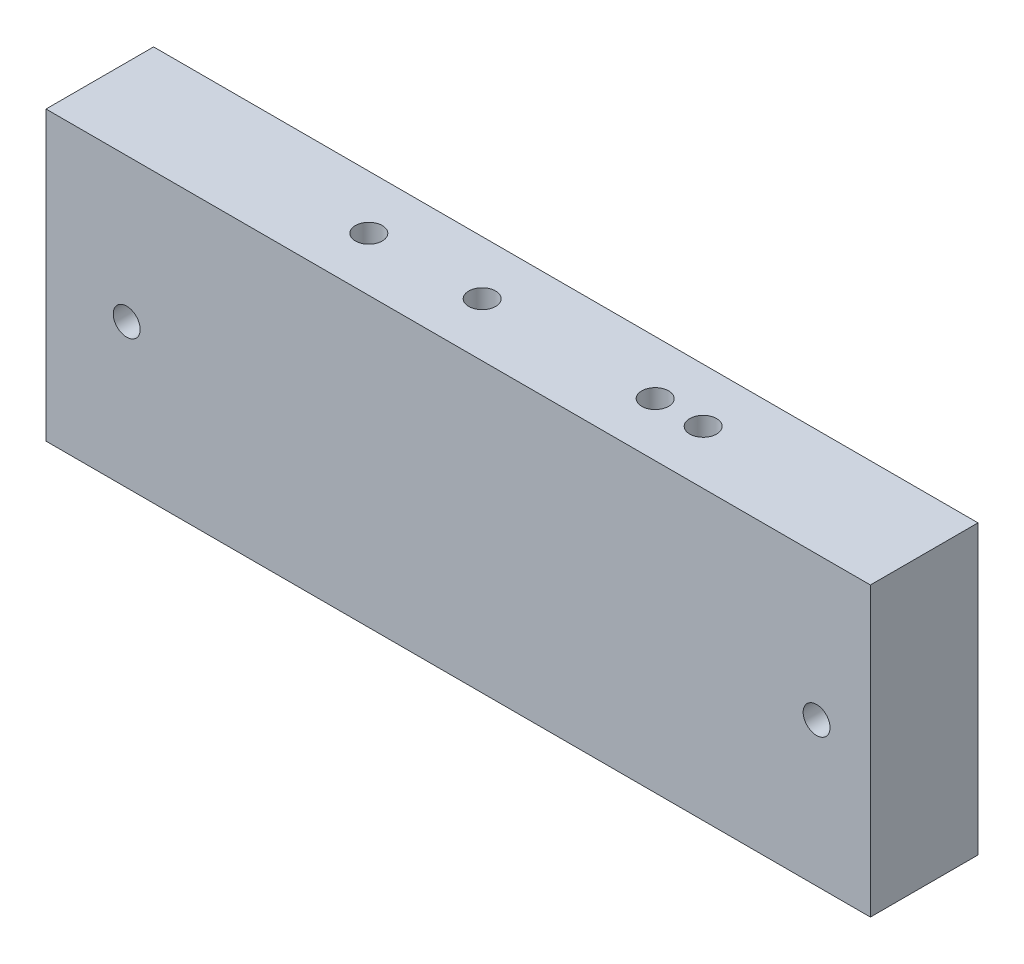
from build123d import *

# Parameters (mm, degrees)
SKETCH1_W           = 97.3
SKETCH1_H           = 33.95
BOSS_EXTRUDE1_DEPTH = 12.7
HOLE1_D             = 3.175
HOLE1_DEPTH         = 31.75
HOLE1_CSINK_D       = 10.16
HOLE1_CSINK_ANGLE   = 82
HOLE1_TIP           = 0.953866233
HOLE2_D             = 3.175
HOLE2_DEPTH         = 31.75
HOLE2_CSINK_D       = 10.16
HOLE2_CSINK_ANGLE   = 82
HOLE2_TIP           = 0.953866233
HOLE5_D             = 3.175
HOLE5_DEPTH         = 31.75
HOLE5_CSINK_D       = 10.16
HOLE5_CSINK_ANGLE   = 82
HOLE5_TIP           = 0.953866233
HOLE6_D             = 3.175
HOLE6_DEPTH         = 31.75
HOLE6_CSINK_D       = 10.16
HOLE6_CSINK_ANGLE   = 82
HOLE6_TIP           = 0.953866233


with BuildPart() as part:
    # Sketch1 → Boss-Extrude1 (new body)
    with BuildSketch(Plane.XY):
        with Locations((-292.654465963, -36.025)):
            Rectangle(SKETCH1_W, SKETCH1_H)
    extrude(amount=-BOSS_EXTRUDE1_DEPTH)

    # Hole1
    with Locations(Plane(origin=(-124.004465969, 0, 78.475709941), x_dir=(-1, 0, 0), z_dir=(0, 1, 0))):
        with Locations((126.349999994, 72.474290059), (146.083333327, -84.825709941), (172.166666661, -84.825709941), (126.349999994, -54.375709941), (126.349999994, 42.024290059), (-172.166666661, -84.825709941), (-146.083333327, -84.825709941), (-126.349999994, -54.375709941), (-126.349999994, 42.024290059), (-126.349999994, 72.474290059)):
            CounterSinkHole(HOLE1_D / 2, HOLE1_CSINK_D / 2, depth=HOLE1_DEPTH, counter_sink_angle=HOLE1_CSINK_ANGLE)
            with Locations((0, 0, -(HOLE1_DEPTH + HOLE1_TIP / 2))):  # 118° drill point
                Cone(0, HOLE1_D / 2, HOLE1_TIP, mode=Mode.SUBTRACT)

    # Hole2
    with Locations(Plane(origin=(-124.004465969, -72.05, 78.475709941), x_dir=(1, 0, 0), z_dir=(0, -1, 0))):
        with Locations((126.349999994, 72.474290059), (146.083333327, -84.825709941), (172.166666661, -84.825709941), (126.349999994, -54.375709941), (126.349999994, 42.024290059), (-172.166666661, -84.825709941), (-146.083333327, -84.825709941), (-126.349999994, -54.375709941), (-126.349999994, 42.024290059), (-126.349999994, 72.474290059)):
            CounterSinkHole(HOLE2_D / 2, HOLE2_CSINK_D / 2, depth=HOLE2_DEPTH, counter_sink_angle=HOLE2_CSINK_ANGLE)
            with Locations((0, 0, -(HOLE2_DEPTH + HOLE2_TIP / 2))):  # 118° drill point
                Cone(0, HOLE2_D / 2, HOLE2_TIP, mode=Mode.SUBTRACT)

    # Hole5
    with Locations(Plane(origin=(-124.004465969, -208.286738577, -12.7), x_dir=(-1, 0, 0), z_dir=(0, 0, -1))):
        with Locations((207.774999994, 172.261738577), (126.349999994, 172.261738577)):
            CounterSinkHole(HOLE5_D / 2, HOLE5_CSINK_D / 2, depth=HOLE5_DEPTH, counter_sink_angle=HOLE5_CSINK_ANGLE)
            with Locations((0, 0, -(HOLE5_DEPTH + HOLE5_TIP / 2))):  # 118° drill point
                Cone(0, HOLE5_D / 2, HOLE5_TIP, mode=Mode.SUBTRACT)

    # Hole6
    with Locations(Plane(origin=(-124.004465969, -6.35, 78.475709941), x_dir=(-1, 0, 0), z_dir=(0, 1, 0))):
        with Locations((-207.774999994, 244.12141023), (-207.774999994, 136.58903684), (-207.774999994, 48.524290059), (-185.549999994, -84.825709941), (-151.749999994, -84.825709941), (-94.599999994, 72.474290059), (94.599999994, 72.474290059), (151.749999994, -84.825709941), (185.549999994, -84.825709941), (207.774999994, 48.524290059), (207.774999994, 136.58903684), (207.774999994, 244.12141023), (166.795833328, 213.070350905), (40.979166666, 213.070350905), (-40.979166666, 213.070350905), (-166.795833328, 213.070350905), (0, 104.224290059), (0, 213.070350905), (0, 323.466411751), (-126.349999994, 34.524290059), (-126.349999994, -46.875709941), (126.349999994, -46.875709941), (126.349999994, 34.524290059)):
            CounterSinkHole(HOLE6_D / 2, HOLE6_CSINK_D / 2, depth=HOLE6_DEPTH, counter_sink_angle=HOLE6_CSINK_ANGLE)
            with Locations((0, 0, -(HOLE6_DEPTH + HOLE6_TIP / 2))):  # 118° drill point
                Cone(0, HOLE6_D / 2, HOLE6_TIP, mode=Mode.SUBTRACT)


solid = part.part
